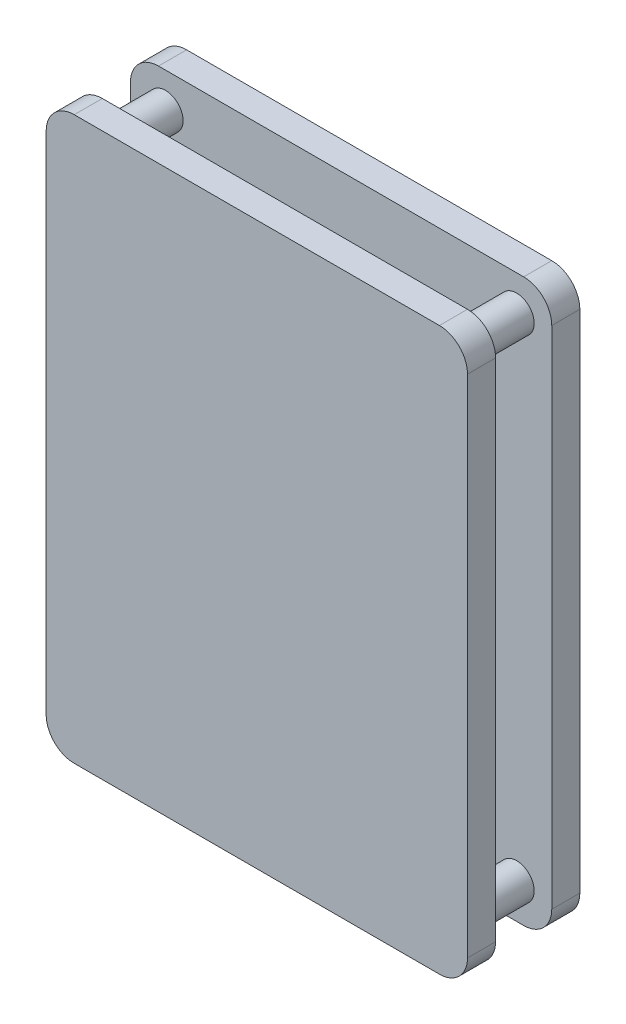
from build123d import *

# Parameters (mm, degrees)
SKETCH1_W           = 30
SKETCH1_H           = 40
BOSS_EXTRUDE1_DEPTH = 2
FILLET1_R           = 2
SKETCH2_R           = 1.25
BOSS_EXTRUDE2_DEPTH = 4
BOSS_EXTRUDE3_START = 2
BOSS_EXTRUDE3_DEPTH = 2


with BuildPart() as part:
    # Sketch1 → Boss-Extrude1 (new body)
    with BuildSketch(Plane.XY):
        with Locations((-68.585871194, -180)):
            Rectangle(SKETCH1_W, SKETCH1_H)
    extrude(amount=BOSS_EXTRUDE1_DEPTH)

    # Fillet1
    fillet1_edges = [part.edges().sort_by_distance(p)[0] for p in [
        (-53.585871194, -160, 1),
        (-83.585871194, -160, 1),
        (-53.585871194, -200, 1),
        (-83.585871194, -200, 1),
    ]]
    fillet(fillet1_edges, radius=FILLET1_R)

    # Sketch2 → Boss-Extrude2 (add)
    with BuildSketch(Plane.XY.offset(2)):
        with Locations((-81.085871194, -197.5)):
            Circle(SKETCH2_R)
        with Locations((-56.085871194, -197.5)):
            Circle(SKETCH2_R)
        with Locations((-56.085871194, -162.5)):
            Circle(SKETCH2_R)
        with Locations((-81.085871194, -162.5)):
            Circle(SKETCH2_R)
    extrude(amount=BOSS_EXTRUDE2_DEPTH)

    # Sketch3 → Boss-Extrude3 (add)
    with BuildSketch(Plane.XY.offset(6).offset(BOSS_EXTRUDE3_START)):
        with BuildLine():
            Line((-53.585871194, -198), (-53.585871194, -162))
            ThreePointArc((-53.585871194, -162), (-54.171657631, -160.585786438), (-55.585871194, -160))
            Line((-55.585871194, -160), (-81.585871194, -160))
            ThreePointArc((-81.585871194, -160), (-83.000084756, -160.585786438), (-83.585871194, -162))
            Line((-83.585871194, -162), (-83.585871194, -198))
            ThreePointArc((-83.585871194, -198), (-83.000084756, -199.414213562), (-81.585871194, -200))
            Line((-81.585871194, -200), (-55.585871194, -200))
            ThreePointArc((-55.585871194, -200), (-54.171657631, -199.414213562), (-53.585871194, -198))
        make_face()
    extrude(amount=-BOSS_EXTRUDE3_DEPTH)


solid = part.part
